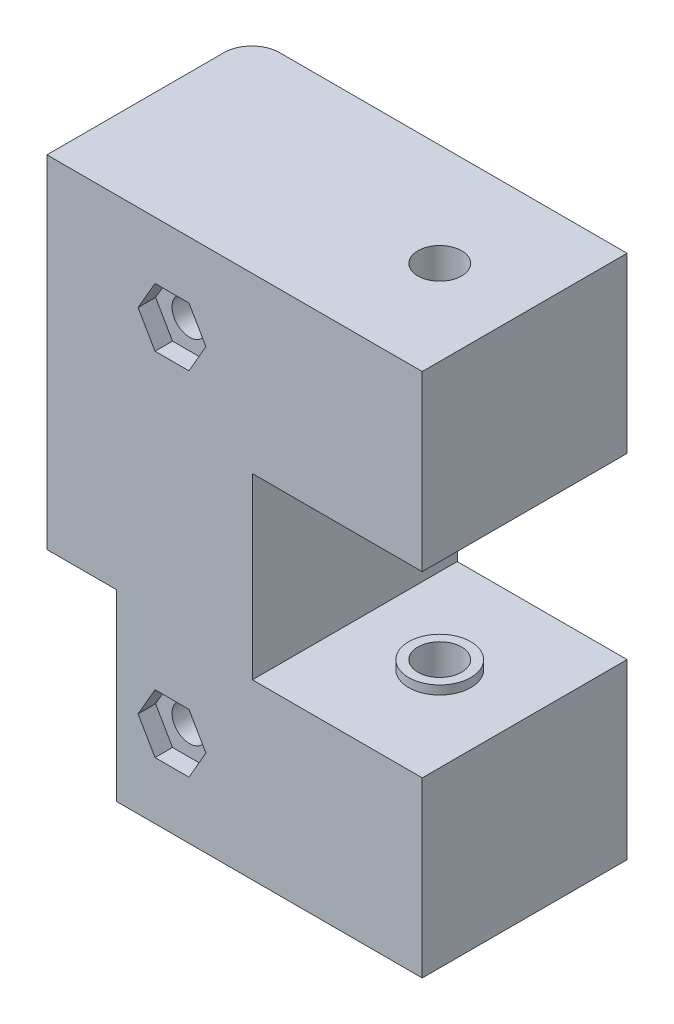
from build123d import *

# Parameters (mm, degrees)
MAINBLOCK_R                     = 2
MAINBLOCKBOSS_EXTRUDE1_DEPTH    = 23.4
TOPHOLECUT_SKETCH2_R            = 2.5
TOPHOLECUT_EXTRUDE1_DEPTH       = 45
MOUNTHOLEBORECUT_EXTRUDE2_DEPTH = 2
TOPSPACERSKETCH4_R              = 3.55
TOPSPACERSKETCH4_R_2            = 2.5
TOPSPACERBOSS_EXTRUDE2_DEPTH    = 1
LOWERSPACERBOSS_EXTRUDE3_START  = 1
LOWERSPACERSKETCH5_R            = 3.55
LOWERSPACERSKETCH5_R_2          = 2.5
LOWERSPACERBOSS_EXTRUDE3_DEPTH  = 1
PUSHPINHOLESKETCH1_R            = 2
PUSHPINHOLECUT_EXTRUDE1_DEPTH   = 78.368117626
MIDRAILINDENTSKETCH1_W          = 7.9375
MIDRAILINDENTSKETCH1_H          = 20.94983
MIDRAILINDENTCUT_EXTRUDE1_DEPTH = 78.368117626
VERTICALSUPPORTFILLET1_R        = 3.175


with BuildPart() as part:
    # MainBlock → MainBlockBoss-Extrude1 (new body)
    with BuildSketch(Plane.XY):
        Polygon((0, 0), (42.875, 0), (42.875, 19.8), (23.475, 19.8), (23.475, 40.2), (42.875, 40.2), (42.875, 60), (0, 60), align=None)
        with Locations((14.2875, 50.1)):
            Circle(MAINBLOCK_R, mode=Mode.SUBTRACT)
        with Locations((14.2875, 9.9)):
            Circle(MAINBLOCK_R, mode=Mode.SUBTRACT)
    extrude(amount=MAINBLOCKBOSS_EXTRUDE1_DEPTH)

    # TopHoleCut-Sketch2 → TopHoleCut-Extrude1 (cut)
    with BuildSketch(Plane(origin=(0, 60, 0), x_dir=(1, 0, 0), z_dir=(0, 1, 0))):
        with Locations((33.175, -11.7)):
            Circle(TOPHOLECUT_SKETCH2_R)
    extrude(amount=-TOPHOLECUT_EXTRUDE1_DEPTH, mode=Mode.SUBTRACT)

    # MountHoleBoreSketch3 → MountHoleBoreCut-Extrude2 (cut)
    with BuildSketch(Plane.XY.offset(23.4)):
        Polygon((18.1625, 50.1), (16.225, 53.45584844), (12.35, 53.45584844), (10.4125, 50.1), (12.35, 46.74415156), (16.225, 46.74415156), align=None)
        Polygon((18.1625, 9.9), (16.225, 13.25584844), (12.35, 13.25584844), (10.4125, 9.9), (12.35, 6.54415156), (16.225, 6.54415156), align=None)
    extrude(amount=-MOUNTHOLEBORECUT_EXTRUDE2_DEPTH, mode=Mode.SUBTRACT)

    # TopSpacerSketch4 → TopSpacerBoss-Extrude2 (add)
    with BuildSketch(Plane.XZ.offset(-40.2)):
        with Locations((33.175, 11.7)):
            Circle(TOPSPACERSKETCH4_R)
        with Locations((33.175, 11.7)):
            Circle(TOPSPACERSKETCH4_R_2, mode=Mode.SUBTRACT)
    extrude(amount=TOPSPACERBOSS_EXTRUDE2_DEPTH)

    # LowerSpacerSketch5 → LowerSpacerBoss-Extrude3 (add)
    with BuildSketch(Plane(origin=(0, 19.8, 0), x_dir=(1, 0, 0), z_dir=(0, 1, 0)).offset(LOWERSPACERBOSS_EXTRUDE3_START)):
        with Locations((33.175, -11.7)):
            Circle(LOWERSPACERSKETCH5_R)
        with Locations((33.175, -11.7)):
            Circle(LOWERSPACERSKETCH5_R_2, mode=Mode.SUBTRACT)
    extrude(amount=-LOWERSPACERBOSS_EXTRUDE3_DEPTH)

    # PushPinHoleSketch1 → PushPinHoleCut-Extrude1 (cut, through all)
    with BuildSketch(Plane.XZ):
        with Locations((33.175, 11.7)):
            Circle(PUSHPINHOLESKETCH1_R)
    extrude(amount=-PUSHPINHOLECUT_EXTRUDE1_DEPTH, mode=Mode.SUBTRACT)

    # MidRailIndentSketch1 → MidRailIndentCut-Extrude1 (cut, through all)
    with BuildSketch(Plane.XY.offset(23.4)):
        with Locations((3.96875, 10.474915)):
            Rectangle(MIDRAILINDENTSKETCH1_W, MIDRAILINDENTSKETCH1_H)
    extrude(amount=-MIDRAILINDENTCUT_EXTRUDE1_DEPTH, mode=Mode.SUBTRACT)

    # VerticalSupportFillet1
    verticalsupportfillet1_edges = [part.edges().sort_by_distance(p)[0] for p in [
        (0, 40.474915, 0),
    ]]
    fillet(verticalsupportfillet1_edges, radius=VERTICALSUPPORTFILLET1_R)


solid = part.part
